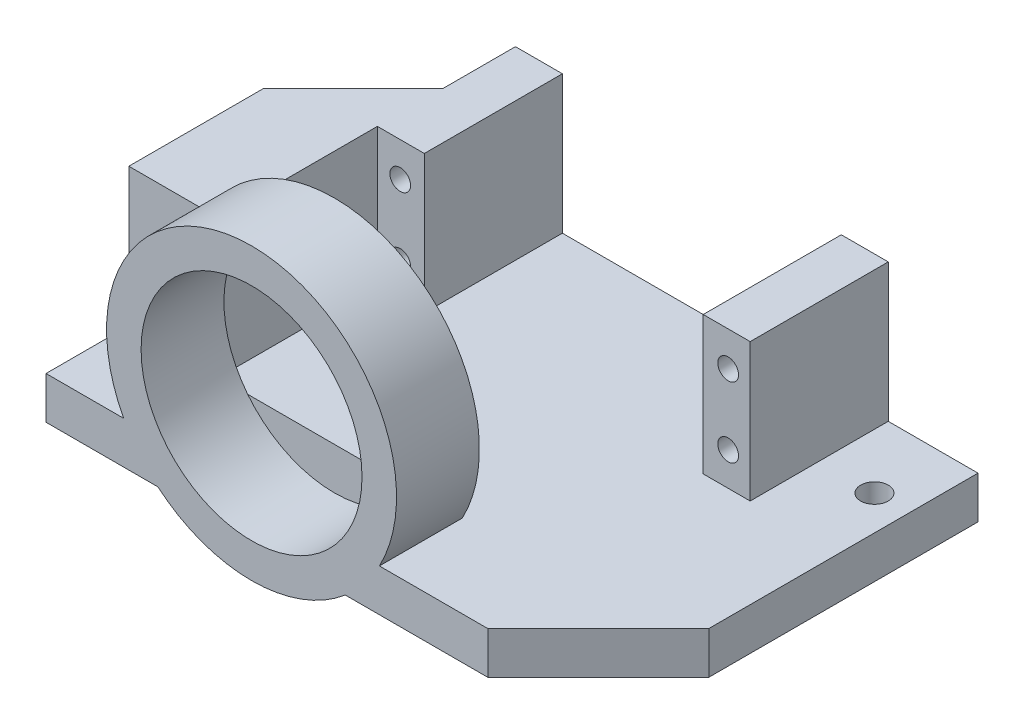
from build123d import *

# Parameters (mm, degrees)
SKETCH1_W           = 80
SKETCH1_H           = 20
BOSS_EXTRUDE1_DEPTH = 6.12
SKETCH14_R          = 2
CUT_EXTRUDE7_DEPTH  = 22.92
SKETCH2_W           = 7
SKETCH2_H           = 20
BOSS_EXTRUDE2_DEPTH = 20
SKETCH3_W           = 80
SKETCH3_H           = 6.12
BOSS_EXTRUDE3_DEPTH = 35
SKETCH5_R           = 21
BOSS_EXTRUDE4_DEPTH = 12
SKETCH4_R           = 16
CUT_EXTRUDE1_DEPTH  = 12
SKETCH7_R           = 1.5
CUT_EXTRUDE2_DEPTH  = 12
CUT_EXTRUDE4_DEPTH  = 10
SKETCH15_W          = 40.4
SKETCH15_H          = 20
CUT_EXTRUDE8_DEPTH  = 20
SKETCH16_W          = 13
SKETCH16_H          = 26
BOSS_EXTRUDE6_DEPTH = 20
CHAMFER1_SIZE       = 6.5


with BuildPart() as part:
    # Sketch1 → Boss-Extrude1 (new body)
    with BuildSketch(Plane(origin=(0, 0, 0), x_dir=(1, 0, 0), z_dir=(0, 1, 0))):
        with Locations((40, 10)):
            Rectangle(SKETCH1_W, SKETCH1_H)
    extrude(amount=BOSS_EXTRUDE1_DEPTH)

    # Sketch14 → Cut-Extrude7 (cut)
    with BuildSketch(Plane(origin=(0, 6.12, 0), x_dir=(1, 0, 0), z_dir=(0, 1, 0))):
        with Locations(Location((75, 10, 0), (0, 0, 270))):
            Circle(SKETCH14_R)
        with Locations(Location((5, 10, 0), (0, 0, 270))):
            Circle(SKETCH14_R)
    extrude(amount=-CUT_EXTRUDE7_DEPTH, mode=Mode.SUBTRACT)

    # Sketch2 → Boss-Extrude2 (add)
    with BuildSketch(Plane(origin=(0, 6.12, 0), x_dir=(1, 0, 0), z_dir=(0, 1, 0))):
        with Locations((16.5, 10)):
            Rectangle(SKETCH2_W, SKETCH2_H)
        with Locations((63.5, 10)):
            Rectangle(SKETCH2_W, SKETCH2_H)
    extrude(amount=BOSS_EXTRUDE2_DEPTH)

    # Sketch3 → Boss-Extrude3 (add)
    with BuildSketch(Plane.XY):
        with Locations((40, 3.06)):
            Rectangle(SKETCH3_W, SKETCH3_H)
    extrude(amount=BOSS_EXTRUDE3_DEPTH)

    # Sketch5 → Boss-Extrude4 (add)
    with BuildSketch(Plane.XY.offset(35)):
        with Locations((29.774, 16.026)):
            Circle(SKETCH5_R)
    extrude(amount=-BOSS_EXTRUDE4_DEPTH)

    # Sketch4 → Cut-Extrude1 (cut)
    with BuildSketch(Plane.XY.offset(35)):
        with Locations((29.774, 16.026)):
            Circle(SKETCH4_R)
    extrude(amount=-CUT_EXTRUDE1_DEPTH, mode=Mode.SUBTRACT)

    # Sketch7 → Cut-Extrude2 (cut)
    with BuildSketch(Plane.XY):
        with Locations((16.312, 21.106)):
            Circle(SKETCH7_R)
        with Locations((16.312, 10.946)):
            Circle(SKETCH7_R)
        with Locations((63.81, 10.946)):
            Circle(SKETCH7_R)
        with Locations((63.81, 21.106)):
            Circle(SKETCH7_R)
    extrude(amount=-CUT_EXTRUDE2_DEPTH, mode=Mode.SUBTRACT)

    # Sketch9 → Cut-Extrude4 (cut)
    with BuildSketch(Plane(origin=(0, 6.12, 0), x_dir=(1, 0, 0), z_dir=(0, 1, 0))):
        Polygon((80, -19), (64, -35), (80, -35), align=None)
    extrude(amount=-CUT_EXTRUDE4_DEPTH, mode=Mode.SUBTRACT)

    # Sketch15 → Cut-Extrude8 (cut)
    with BuildSketch(Plane(origin=(0, 26.12, 0), x_dir=(1, 0, 0), z_dir=(0, 1, 0))):
        with Locations((40, 10)):
            Rectangle(SKETCH15_W, SKETCH15_H)
    extrude(amount=-CUT_EXTRUDE8_DEPTH, mode=Mode.SUBTRACT)

    # Sketch16 → Boss-Extrude6 (add)
    with BuildSketch(Plane(origin=(0, 6.12, 0), x_dir=(1, 0, 0), z_dir=(0, 1, 0))):
        with Locations((6.5, -10)):
            Rectangle(SKETCH16_W, SKETCH16_H)
    extrude(amount=BOSS_EXTRUDE6_DEPTH)

    # Chamfer1
    chamfer1_edges = [part.edges().sort_by_distance(p)[0] for p in [
        (13, 16.12, -3),
    ]]
    chamfer(chamfer1_edges, length=CHAMFER1_SIZE)
    chamfer1_2_edges = [part.edges().sort_by_distance(p)[0] for p in [
        (0, 16.12, -3),
    ]]
    chamfer(chamfer1_2_edges, length=CHAMFER1_SIZE - 0.0001)  # a hair under: the kernel refuses the full size


solid = part.part
